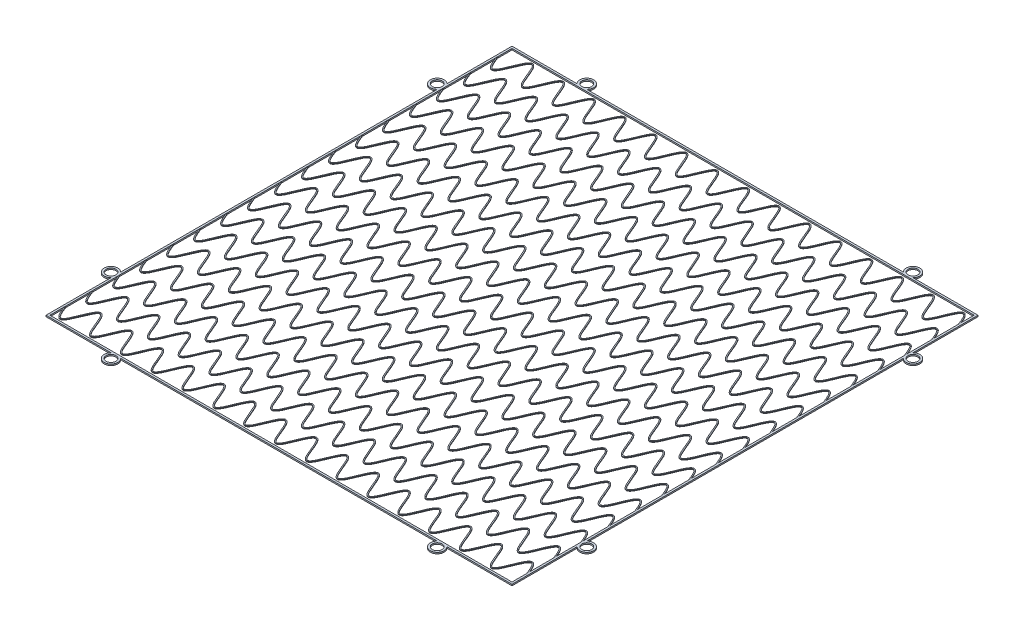
from build123d import *

# Parameters (mm, degrees)
SKETCH1_W                     = 190
SKETCH1_H                     = 190
SKETCH1_W_2                   = 188.4
SKETCH1_H_2                   = 188.4
BOSS_EXTRUDE1_DEPTH           = 0.28
SKETCH5_R                     = 2.8
SKETCH5_R_2                   = 2
BOSS_EXTRUDE5_DEPTH           = 0.28
CIRPATTERN1_COPY_1_SKETCH_R   = 2.8
CIRPATTERN1_COPY_1_SKETCH_R_2 = 2
CIRPATTERN1_COPY_1_DEPTH      = 0.28
CIRPATTERN1_COPY_2_SKETCH_R   = 2.8
CIRPATTERN1_COPY_2_SKETCH_R_2 = 2
CIRPATTERN1_COPY_2_DEPTH      = 0.28
CIRPATTERN1_COPY_3_SKETCH_R   = 2.8
CIRPATTERN1_COPY_3_SKETCH_R_2 = 2
CIRPATTERN1_COPY_3_DEPTH      = 0.28
CIRPATTERN1_COPY_4_SKETCH_R   = 2.8
CIRPATTERN1_COPY_4_SKETCH_R_2 = 2
CIRPATTERN1_COPY_4_DEPTH      = 0.28
CIRPATTERN1_COPY_5_SKETCH_R   = 2.8
CIRPATTERN1_COPY_5_SKETCH_R_2 = 2
CIRPATTERN1_COPY_5_DEPTH      = 0.28
CIRPATTERN1_COPY_6_SKETCH_R   = 2.8
CIRPATTERN1_COPY_6_SKETCH_R_2 = 2
CIRPATTERN1_COPY_6_DEPTH      = 0.28
BOSS_EXTRUDE7_DEPTH           = 0.14
LPATTERN6_COUNT               = 9
LPATTERN6_PITCH               = 11
LPATTERN6_COL_COUNT           = 9
LPATTERN6_COL_PITCH           = 11


with BuildPart() as part:
    # Sketch1 → Boss-Extrude1 (new, symmetric)
    with BuildSketch(Plane(origin=(0, 0, 0), x_dir=(1, 0, 0), z_dir=(0, 1, 0))):
        Rectangle(SKETCH1_W, SKETCH1_H)
        Rectangle(SKETCH1_W_2, SKETCH1_H_2, mode=Mode.SUBTRACT)
    extrude(amount=BOSS_EXTRUDE1_DEPTH, both=True)

    # Sketch5 → Boss-Extrude5 (add, symmetric)
    with BuildSketch(Plane(origin=(0, 0, 0), x_dir=(1, 0, 0), z_dir=(0, 1, 0))):
        with Locations((-66.5, 97)):
            Circle(SKETCH5_R)
        with Locations((-66.5, 97)):
            Circle(SKETCH5_R_2, mode=Mode.SUBTRACT)
    boss_extrude5 = extrude(amount=BOSS_EXTRUDE5_DEPTH, both=True)

    # Mirror2: Boss-Extrude5 across plane
    add(boss_extrude5.mirror(Plane(origin=(0, 0, 0), x_dir=(0, 0, 1), z_dir=(1, 0, 0))))

    # CirPattern1 copy 1 sketch → CirPattern1 copy 1 (add, symmetric)
    with BuildSketch(Plane.ZX):
        with Locations((-66.5, -97)):
            Circle(CIRPATTERN1_COPY_1_SKETCH_R)
        with Locations((-66.5, -97)):
            Circle(CIRPATTERN1_COPY_1_SKETCH_R_2, mode=Mode.SUBTRACT)
    extrude(amount=CIRPATTERN1_COPY_1_DEPTH, both=True)

    # CirPattern1 copy 2 sketch → CirPattern1 copy 2 (add, symmetric)
    with BuildSketch(Plane(origin=(0, 0, 0), x_dir=(1, 0, 0), z_dir=(0, 1, 0))):
        with Locations((-66.5, -97)):
            Circle(CIRPATTERN1_COPY_2_SKETCH_R)
        with Locations((-66.5, -97)):
            Circle(CIRPATTERN1_COPY_2_SKETCH_R_2, mode=Mode.SUBTRACT)
    extrude(amount=CIRPATTERN1_COPY_2_DEPTH, both=True)

    # CirPattern1 copy 3 sketch → CirPattern1 copy 3 (add, symmetric)
    with BuildSketch(Plane(origin=(0, 0, 0), x_dir=(0, 0, -1), z_dir=(0, 1, 0))):
        with Locations((-66.5, -97)):
            Circle(CIRPATTERN1_COPY_3_SKETCH_R)
        with Locations((-66.5, -97)):
            Circle(CIRPATTERN1_COPY_3_SKETCH_R_2, mode=Mode.SUBTRACT)
    extrude(amount=CIRPATTERN1_COPY_3_DEPTH, both=True)

    # CirPattern1 copy 4 sketch → CirPattern1 copy 4 (add, symmetric)
    with BuildSketch(Plane(origin=(0, 0, 0), x_dir=(0, 0, -1), z_dir=(0, 1, 0))):
        with Locations((-66.5, 97)):
            Circle(CIRPATTERN1_COPY_4_SKETCH_R)
        with Locations((-66.5, 97)):
            Circle(CIRPATTERN1_COPY_4_SKETCH_R_2, mode=Mode.SUBTRACT)
    extrude(amount=CIRPATTERN1_COPY_4_DEPTH, both=True)

    # CirPattern1 copy 5 sketch → CirPattern1 copy 5 (add, symmetric)
    with BuildSketch(Plane(origin=(0, 0, 0), x_dir=(-1, 0, 0), z_dir=(0, 1, 0))):
        with Locations((-66.5, 97)):
            Circle(CIRPATTERN1_COPY_5_SKETCH_R)
        with Locations((-66.5, 97)):
            Circle(CIRPATTERN1_COPY_5_SKETCH_R_2, mode=Mode.SUBTRACT)
    extrude(amount=CIRPATTERN1_COPY_5_DEPTH, both=True)

    # CirPattern1 copy 6 sketch → CirPattern1 copy 6 (add, symmetric)
    with BuildSketch(Plane.ZX):
        with Locations((-66.5, 97)):
            Circle(CIRPATTERN1_COPY_6_SKETCH_R)
        with Locations((-66.5, 97)):
            Circle(CIRPATTERN1_COPY_6_SKETCH_R_2, mode=Mode.SUBTRACT)
    extrude(amount=CIRPATTERN1_COPY_6_DEPTH, both=True)

    # Sketch7 → Boss-Extrude7 (add, symmetric)
    with BuildSketch(Plane(origin=(0, 0, 0), x_dir=(1, 0, 0), z_dir=(0, 1, 0))):
        with BuildLine():
            Line((-94.685489828, 0.554091088), (-94.314510172, 0.703670816))
            add(Edge.make_bspline(
                [(-94.314510172, 0.703670816), (-94.128494798, 0.242325418), (-93.761903233, -0.683203832), (-93.192852688, -2.059886185), (-92.667618905, -3.177428949), (-92.165540755, -4.007346752), (-91.716185593, -4.563714084), (-91.156659676, -4.893908285), (-90.586699039, -4.648705896), (-90.117716455, -4.109195202), (-89.603580132, -3.29121727), (-89.070727979, -2.177262894), (-88.499213638, -0.804867906), (-87.948749701, 0.583320642), (-87.477891527, 1.739855344), (-87.070151195, 2.656429537), (-86.738685712, 3.336121208), (-86.364064729, 4.000121082), (-85.989384643, 4.530070706), (-85.602894778, 4.908235083), (-85.24048297, 5.143238917), (-84.769176765, 5.23751202), (-84.317703486, 5.098514882), (-83.976320958, 4.850935351), (-83.602591101, 4.460581349), (-83.239889018, 3.932726938), (-82.866977154, 3.256968888), (-82.436109528, 2.362617595), (-81.940629106, 1.191906265), (-81.404119165, -0.156617005), (-80.881594555, -1.456526327), (-80.310521193, -2.755938727), (-79.763427295, -3.788613147), (-79.204522614, -4.503760835), (-78.681734974, -4.866897038), (-78.134169762, -4.733775295), (-77.504623811, -4.091671717), (-76.927633096, -3.081733452), (-76.341238658, -1.798914294), (-75.805723227, -0.484745389), (-75.280833872, 0.837530825), (-74.73578358, 2.158497939), (-74.230570506, 3.243228942), (-73.744107916, 4.084822884), (-73.376837506, 4.582795777), (-72.998253455, 4.93823565), (-72.643031682, 5.153663512), (-72.193280663, 5.233087602), (-71.622403123, 5.058207659), (-71.144933526, 4.601577433), (-70.716453303, 4.001197283), (-70.358388712, 3.367671466), (-69.934214501, 2.506169151), (-69.463818009, 1.409614608), (-68.93403426, 0.087170552), (-68.40710164, -1.233210684), (-67.8485313, -2.530929663), (-67.318973699, -3.579274036), (-66.794288718, -4.325238123), (-66.306441529, -4.781384183), (-65.757413329, -4.841515331), (-65.2471057, -4.435520195), (-64.83806065, -3.891747249), (-64.370642442, -3.089498002), (-63.872602729, -2.025572153), (-63.331136384, -0.715245093), (-62.806562432, 0.60649047), (-62.267758617, 1.928651361), (-61.774340878, 3.017452795), (-61.312387097, 3.867163697), (-60.900986581, 4.477453287), (-60.461950739, 4.946273679), (-59.94895651, 5.19887112), (-59.488144509, 5.212686878), (-59.089178427, 5.039114683), (-58.677180963, 4.706736222), (-58.28954234, 4.215226754), (-57.911363977, 3.590967875), (-57.471787283, 2.733999354), (-56.99238117, 1.64031626), (-56.45916812, 0.318115607), (-55.933858808, -1.00359516), (-55.38373935, -2.30639441), (-54.86971653, -3.365039626), (-54.372971049, -4.136324684), (-53.923994577, -4.645283521), (-53.382888306, -4.886096357), (-52.846506633, -4.606052852), (-52.405750349, -4.088585077), (-51.916622398, -3.30972331), (-51.405005409, -2.250864972), (-50.857182703, -0.945551942), (-50.331920909, 0.375573056), (-49.797882188, 1.698157737), (-49.315712806, 2.791196448), (-48.872236359, 3.645929042), (-48.487886558, 4.269423317), (-48.091895373, 4.755706226), (-47.662785204, 5.077336705), (-47.246075073, 5.226676592), (-46.789987449, 5.174638744), (-46.300349108, 4.899112528), (-45.873174771, 4.425955905), (-45.469954098, 3.811914845), (-45.012091608, 2.961188527), (-44.522226108, 1.870677362), (-43.9845252, 0.549043554), (-43.459909943, -0.773332808), (-42.916949649, -2.08133411), (-42.416097256, -3.146182478), (-41.943051054, -3.940773153), (-41.527446183, -4.480163119), (-41.008654755, -4.859073947), (-40.460677237, -4.751332344), (-39.981974331, -4.277957237), (-39.466270131, -3.526698179), (-38.939473518, -2.475100949), (-38.383855818, -1.175425136), (-37.857047496, 0.144693649), (-37.326685146, 1.467457173), (-36.854270171, 2.563612341), (-36.42615035, 3.42324648), (-36.063743808, 4.055380223), (-35.700350052, 4.555142803), (-35.328659748, 4.914505247), (-34.982015773, 5.136961034), (-34.538770972, 5.234602119), (-34.101953654, 5.122248089), (-33.762022921, 4.893722158), (-33.395900343, 4.533031331), (-33.035951505, 4.029512197), (-32.555254024, 3.187894749), (-32.053708871, 2.100470333), (-31.510238874, 0.779970273), (-30.985318855, -0.542577167), (-30.448907084, -1.85578361), (-29.858985143, -3.136817427), (-29.275260434, -4.143687594), (-28.633160376, -4.76558864), (-28.084348201, -4.851526211), (-27.569612614, -4.45991345), (-27.019746319, -3.737704329), (-26.476527624, -2.698820184), (-25.911284672, -1.404567107), (-25.382098139, -0.08617039), (-24.854432582, 1.236631702), (-24.39020451, 2.334946358), (-23.975334514, 3.199331985), (-23.630845631, 3.837158742), (-23.223444904, 4.449618291), (-22.791082488, 4.92093161), (-22.291173985, 5.186311582), (-21.832200548, 5.221112497), (-21.423465799, 5.060211559), (-21.002629267, 4.733435363), (-20.610136743, 4.244230333), (-20.228946242, 3.621151892), (-19.897359929, 2.979035879), (-19.494497965, 2.110431841), (-19.03663901, 1.010805281), (-18.510539009, -0.311863596), (-17.978571083, -1.628077869), (-17.401565119, -2.916855507), (-16.840172716, -3.938511855), (-16.249056893, -4.624106884), (-15.710005585, -4.88663591), (-15.170892188, -4.627737831), (-14.578014886, -3.943343427), (-14.016491817, -2.921397598), (-13.439666288, -1.632980836), (-12.9072041, -0.31694345), (-12.381370571, 1.005711662), (-11.923708982, 2.105508307), (-11.520828402, 2.974207402), (-11.189788345, 3.615685301), (-10.808715564, 4.240611419), (-10.417784145, 4.728917382), (-9.997666945, 5.056897917), (-9.590660393, 5.219878709), (-9.131329036, 5.188453153), (-8.629005584, 4.924668757), (-8.195408843, 4.454090383), (-7.788391532, 3.841819284), (-7.442709359, 3.204507417), (-7.028189502, 2.339661875), (-6.563542195, 1.241667547), (-6.035641176, -0.08094434), (-5.506913501, -1.399841973), (-4.941323937, -2.693927294), (-4.398769275, -3.73216921), (-3.850203087, -4.45651805), (-3.335664339, -4.849861734), (-2.786866708, -4.768336161), (-2.14309731, -4.147370411), (-1.559406929, -3.141104911), (-0.969284451, -1.860933993), (-0.432492078, -0.54742431), (0.092298065, 0.774572311), (0.635459327, 2.096219287), (1.137441025, 3.181241724), (1.616504064, 4.026980644), (2.049040838, 4.623348211), (2.535068196, 5.078364427), (3.11570811, 5.234858089), (3.559880349, 5.139827931), (3.908209744, 4.917734888), (4.280640002, 4.560833088), (4.64452035, 4.058905987), (5.007910475, 3.42885769), (5.435935562, 2.568114264), (5.908692127, 1.472469752), (6.439297166, 0.150015374), (6.965695509, -1.170791073), (7.521836137, -2.469866243), (8.04689674, -3.521485774), (8.563506248, -4.274594006), (9.040657172, -4.748433665), (9.588684072, -4.860520428), (10.107407287, -4.483630995), (10.524409018, -3.946091042), (10.99734601, -3.149608943), (11.498920672, -2.087022616), (12.041988029, -0.777952772), (12.566665858, 0.54363949), (13.10405011, 1.865944382), (13.594283143, 2.95601925), (14.050798535, 3.80711305), (14.454320772, 4.421612373), (14.880353675, 4.895424935), (15.367574466, 5.172239049), (15.82315222, 5.227582354), (16.24136579, 5.080645713), (16.671583366, 4.759956103), (17.069038542, 4.273146876), (17.453438663, 3.651306643), (17.897698565, 2.795925246), (18.379791394, 1.70304243), (18.914119227, 0.380968305), (19.439148541, -0.940978456), (19.987197271, -2.245215524), (20.497411257, -3.305837628), (20.987352593, -4.083771478), (21.426391913, -4.602337983), (21.962914499, -4.885905189), (22.504059125, -4.648740003), (22.954602695, -4.140828807), (23.450403734, -3.36921967), (23.965996137, -2.311971932), (24.515786368, -1.008170741), (25.041384316, 0.312734247), (25.574319667, 1.63538497), (26.053684062, 2.729384853), (26.49271395, 3.585444171), (26.870669164, 4.211694826), (27.256705442, 4.70192738), (27.668316244, 5.035846508), (28.065362869, 5.211133562), (28.526356426, 5.200748076), (29.041711292, 4.950083713), (29.482108397, 4.482051058), (29.893127573, 3.871709584), (30.356574162, 3.022820495), (30.849554869, 1.933320528), (31.388677844, 0.611887266), (31.913260587, -0.710590438), (32.454472687, -2.019919703), (32.952142941, -3.086122136), (33.419233229, -3.886336954), (33.827481823, -4.432395441), (34.337397294, -4.839555909), (34.886312762, -4.784108414), (35.375582298, -4.328326831), (35.899734166, -3.584779125), (36.43087732, -2.536034936), (36.988921482, -1.23787233), (37.516289942, 0.08187175), (38.045842035, 1.404599529), (38.515820482, 2.501607559), (38.940267568, 3.362191199), (39.297093596, 3.997251247), (39.725737042, 4.596389441), (40.201058985, 5.05432859), (40.77031624, 5.232509506), (41.220713353, 5.156442557), (41.577854005, 4.941354366), (41.956865287, 4.588484076), (42.324983464, 4.088317329), (42.812469083, 3.249339212), (43.317602943, 2.162936282), (43.862852517, 0.842842555), (44.387939285, -0.479833638), (44.923027252, -1.793832621), (45.509330121, -3.07739281), (46.086401577, -4.087709765), (46.714282443, -4.730843856), (47.26174491, -4.868053755), (47.784405238, -4.507451862), (48.345093203, -3.794085768), (48.893051961, -2.759568721), (49.461254965, -1.466795825), (49.991242076, -0.148994631), (50.518317381, 1.17379921), (50.980629777, 2.272548528), (51.392074394, 3.138212129), (51.732618908, 3.777040182), (52.132302242, 4.393447552), (52.552284455, 4.869736058), (53.027350661, 5.156811928), (53.478062765, 5.232009496), (53.905284509, 5.100329689), (54.345430897, 4.786305588), (54.748017018, 4.30197338), (55.135644268, 3.681410003), (55.470833956, 3.040527397), (55.876681804, 2.172872364), (56.336275866, 1.073645535), (56.862775787, -0.249027995), (57.393769152, -1.566038671), (57.967462056, -2.856347132), (58.523597564, -3.882732842), (59.101907395, -4.580266038), (59.635812709, -4.883753658), (60.179123826, -4.669380464), (60.785244972, -3.998812548), (61.352265786, -2.981571918), (61.932573733, -1.69505059), (62.466091476, -0.37971277), (62.991588614, 0.942840961), (63.44766564, 2.042989372), (63.847577855, 2.91269042), (64.175372409, 3.555145043), (64.550227593, 4.182691228), (64.931582668, 4.674755106), (65.335095161, 5.014237014), (65.722124457, 5.200556887), (66.183170096, 5.211366129), (66.711690298, 4.97534857), (67.159447575, 4.509837188), (67.574400175, 3.901546241), (67.924423896, 3.265622528), (68.342446571, 2.401958639), (68.809151782, 1.304478931), (69.337703189, -0.018083637), (69.865699267, -1.337581078), (70.428562841, -2.633041433), (70.966120793, -3.675254843), (71.505269898, -4.408242002), (72.010429765, -4.82794938), (72.559654932, -4.799153131), (73.053936218, -4.353063775), (73.450785419, -3.799457336), (73.909505611, -2.988718916), (74.401903323, -1.922435375), (74.94088963, -0.610226538), (75.465416345, 0.711727684), (76.006866663, 2.033590364), (76.505663485, 3.120059049), (76.977807075, 3.967396084), (77.402588347, 4.569321891), (77.868196232, 5.029886184), (78.425202208, 5.228066965), (78.8805418, 5.17183914), (79.246864592, 4.96458432), (79.632806173, 4.615978164), (80.005121286, 4.117595171), (80.373765922, 3.489538744), (80.697916928, 2.84525105), (80.996567122, 2.189886425), (81.274744368, 1.53830723), (81.538784563, 0.894040148), (81.828608358, 0.170778564), (82.127041486, -0.576041276), (82.517299355, -1.534559041), (83.041542662, -2.741559), (83.644650732, -3.879582985), (84.297242515, -4.651524768), (84.901034271, -4.901286772), (85.486537893, -4.515224254), (86.098488941, -3.713122173), (86.6897854, -2.557622909), (87.304870088, -1.117191451), (87.886047442, 0.34553715), (88.378217338, 1.566240649), (88.802622342, 2.534562022), (89.146954004, 3.253149213), (89.536216163, 3.955511446), (89.926647561, 4.517010824), (90.333221927, 4.915800757), (90.721000837, 5.161547025), (91.227936433, 5.235471282), (91.68533783, 5.057930318), (92.027788106, 4.781996448), (92.40111828, 4.363821337), (92.771402606, 3.795474058), (93.148613103, 3.086511331), (93.597350827, 2.127687896), (94.103491087, 0.906597852), (94.489184093, -0.067224085), (94.685489828, -0.554091088)],
                knots=[0.003165429, 0.003165429, 0.003165429, 0.003165429, 0.007047133, 0.010928837, 0.014810542, 0.016751394, 0.018692246, 0.020633099, 0.022573951, 0.024514803, 0.026455655, 0.03033736, 0.034219064, 0.038100769, 0.041982473, 0.043923325, 0.045864178, 0.04780503, 0.049745882, 0.050716308, 0.051686734, 0.05265716, 0.053627586, 0.054598013, 0.055568439, 0.057509291, 0.059450143, 0.061390995, 0.0652727, 0.069154404, 0.073036109, 0.076917813, 0.080799518, 0.08274037, 0.084681222, 0.086622074, 0.088562927, 0.092444631, 0.096326335, 0.10020804, 0.104089744, 0.107971449, 0.111853153, 0.113794005, 0.115734858, 0.116705284, 0.11767571, 0.118646136, 0.119616562, 0.121557414, 0.123498267, 0.125439119, 0.127379971, 0.131261675, 0.13514338, 0.139025084, 0.142906789, 0.146788493, 0.148729346, 0.150670198, 0.15261105, 0.154551902, 0.156492754, 0.158433607, 0.162315311, 0.166197016, 0.17007872, 0.173960424, 0.177842129, 0.179782981, 0.181723833, 0.183664686, 0.184635112, 0.185605538, 0.186575964, 0.18754639, 0.189487242, 0.191428095, 0.193368947, 0.197250651, 0.201132356, 0.20501406, 0.208895765, 0.212777469, 0.214718321, 0.216659173, 0.218600026, 0.220540878, 0.22248173, 0.224422582, 0.228304287, 0.232185991, 0.236067696, 0.2399494, 0.243831105, 0.245771957, 0.247712809, 0.249653661, 0.250624087, 0.251594514, 0.25256494, 0.253535366, 0.255476218, 0.25741707, 0.259357922, 0.263239627, 0.267121331, 0.271003036, 0.27488474, 0.278766445, 0.280707297, 0.282648149, 0.284589001, 0.286529854, 0.288470706, 0.290411558, 0.294293263, 0.298174967, 0.302056671, 0.305938376, 0.30982008, 0.311760933, 0.313701785, 0.315642637, 0.316613063, 0.317583489, 0.318553915, 0.319524341, 0.320494768, 0.321465194, 0.323406046, 0.325346898, 0.329228603, 0.333110307, 0.336992011, 0.340873716, 0.34475542, 0.348637125, 0.350577977, 0.352518829, 0.354459682, 0.356400534, 0.360282238, 0.364163943, 0.368045647, 0.371927352, 0.375809056, 0.377749908, 0.37969076, 0.381631613, 0.383572465, 0.384542891, 0.385513317, 0.386483743, 0.387454169, 0.389395022, 0.391335874, 0.393276726, 0.395217578, 0.399099283, 0.402980987, 0.406862692, 0.410744396, 0.414626101, 0.416566953, 0.418507805, 0.420448657, 0.422389509, 0.426271214, 0.430152918, 0.434034623, 0.437916327, 0.441798032, 0.443738884, 0.445679736, 0.447620588, 0.449561441, 0.450531867, 0.451502293, 0.452472719, 0.453443145, 0.455383997, 0.45732485, 0.459265702, 0.461206554, 0.465088258, 0.468969963, 0.472851667, 0.476733372, 0.480615076, 0.482555928, 0.484496781, 0.486437633, 0.488378485, 0.49226019, 0.496141894, 0.500023598, 0.503905303, 0.507787007, 0.511668712, 0.513609564, 0.515550416, 0.517491269, 0.518461695, 0.519432121, 0.520402547, 0.521372973, 0.523313825, 0.525254677, 0.52719553, 0.531077234, 0.534958939, 0.538840643, 0.542722347, 0.546604052, 0.548544904, 0.550485756, 0.552426609, 0.554367461, 0.556308313, 0.558249165, 0.56213087, 0.566012574, 0.569894279, 0.573775983, 0.577657688, 0.57959854, 0.581539392, 0.583480244, 0.58445067, 0.585421096, 0.586391523, 0.587361949, 0.589302801, 0.591243653, 0.593184505, 0.59706621, 0.600947914, 0.604829619, 0.608711323, 0.612593028, 0.61453388, 0.616474732, 0.618415584, 0.620356437, 0.622297289, 0.624238141, 0.628119845, 0.63200155, 0.635883254, 0.639764959, 0.643646663, 0.645587515, 0.647528368, 0.64946922, 0.650439646, 0.651410072, 0.652380498, 0.653350924, 0.655291777, 0.657232629, 0.659173481, 0.663055185, 0.66693689, 0.670818594, 0.674700299, 0.678582003, 0.680522856, 0.682463708, 0.68440456, 0.686345412, 0.688286264, 0.690227117, 0.694108821, 0.697990526, 0.70187223, 0.705753934, 0.709635639, 0.711576491, 0.713517343, 0.715458196, 0.717399048, 0.718369474, 0.7193399, 0.720310326, 0.721280752, 0.723221605, 0.725162457, 0.729044161, 0.732925866, 0.73680757, 0.740689275, 0.744570979, 0.748452683, 0.750393536, 0.752334388, 0.75427524, 0.756216092, 0.760097797, 0.763979501, 0.767861206, 0.77174291, 0.775624615, 0.777565467, 0.779506319, 0.781447171, 0.783388024, 0.78435845, 0.785328876, 0.786299302, 0.787269728, 0.78921058, 0.791151432, 0.793092285, 0.795033137, 0.798914841, 0.802796546, 0.80667825, 0.810559955, 0.814441659, 0.816382511, 0.818323364, 0.820264216, 0.822205068, 0.826086773, 0.829968477, 0.833850181, 0.837731886, 0.84161359, 0.843554443, 0.845495295, 0.847436147, 0.849376999, 0.850347425, 0.851317851, 0.852288278, 0.853258704, 0.855199556, 0.857140408, 0.85908126, 0.861022113, 0.864903817, 0.868785521, 0.872667226, 0.87654893, 0.880430635, 0.882371487, 0.884312339, 0.886253192, 0.888194044, 0.890134896, 0.892075748, 0.895957453, 0.899839157, 0.903720862, 0.907602566, 0.91148427, 0.913425123, 0.915365975, 0.917306827, 0.918277253, 0.919247679, 0.920218105, 0.921188532, 0.923129384, 0.925070236, 0.927011088, 0.92895194, 0.930892793, 0.932833645, 0.934774497, 0.936715349, 0.938656202, 0.942537906, 0.946419611, 0.948360463, 0.950301315, 0.952242167, 0.954183019, 0.958064724, 0.961946428, 0.965828133, 0.969709837, 0.971650689, 0.973591542, 0.975532394, 0.977473246, 0.978443672, 0.979414098, 0.980384524, 0.981354951, 0.982325377, 0.983295803, 0.985236655, 0.987177507, 0.98911836, 0.993000064, 0.996881768, 0.996881768, 0.996881768, 0.996881768], degree=3))
            Line((94.685489828, -0.554091088), (94.314510172, -0.703670816))
            add(Edge.make_bspline(
                [(-94.685489828, 0.554091088), (-94.499408378, 0.092581811), (-94.133642052, -0.83013856), (-93.655676225, -1.989545284), (-93.238410086, -2.900108336), (-92.8932455, -3.578198071), (-92.496977127, -4.232297741), (-92.085559863, -4.747075316), (-91.636134725, -5.084790482), (-91.192399426, -5.23496878), (-90.716171987, -5.155664576), (-90.22487776, -4.847905595), (-89.792462212, -4.343053319), (-89.382928485, -3.69269154), (-89.031560975, -3.019666497), (-88.607715946, -2.107954278), (-88.128010118, -0.953394921), (-87.577103016, 0.435756207), (-87.014755914, 1.814645091), (-86.503233919, 2.938636051), (-86.023362461, 3.789990263), (-85.607680941, 4.373057567), (-85.08078493, 4.830862209), (-84.503279776, 4.797297582), (-83.988278684, 4.312124406), (-83.445973676, 3.526359109), (-82.897600321, 2.42425604), (-82.31222601, 1.044357638), (-81.775835607, -0.304624574), (-81.251201874, -1.608969916), (-80.769375391, -2.70800017), (-80.333187345, -3.565702736), (-79.956237089, -4.191433638), (-79.573430242, -4.684699366), (-79.167980792, -5.020930126), (-78.777289453, -5.204340372), (-78.316312124, -5.208073296), (-77.79217188, -4.967298665), (-77.347234037, -4.500532429), (-76.932480806, -3.892170103), (-76.468135398, -3.043041766), (-75.973374873, -1.95479891), (-75.433946419, -0.632704962), (-74.909398094, 0.689088136), (-74.368573921, 1.999907054), (-73.871968992, 3.064413053), (-73.40678436, 3.868901354), (-73.00089101, 4.415192029), (-72.494433096, 4.832119955), (-71.945105571, 4.79408072), (-71.452157277, 4.34582924), (-70.925713455, 3.603081443), (-70.392673101, 2.557077695), (-69.833920147, 1.258663154), (-69.306028545, -0.060336962), (-68.777295913, -1.383743043), (-68.307147017, -2.480307872), (-67.885027688, -3.341686649), (-67.529076242, -3.977624768), (-67.104052536, -4.577764217), (-66.634780709, -5.037888903), (-66.073683967, -5.229769895), (-65.619628941, -5.166815339), (-65.25689338, -4.957664557), (-64.87236001, -4.605809774), (-64.501843783, -4.10931748), (-64.134378218, -3.478906286), (-63.810445017, -2.835210265), (-63.414091535, -1.964353451), (-62.959895834, -0.863786284), (-62.434724144, 0.458593861), (-61.899771656, 1.773045465), (-61.314898189, 3.056860441), (-60.740535218, 4.068526159), (-60.116873627, 4.718414369), (-59.570212275, 4.872587365), (-59.044411585, 4.522806199), (-58.481100541, 3.81294507), (-57.930618769, 2.780398155), (-57.361658776, 1.487548478), (-56.831131756, 0.170423919), (-56.304547085, -1.152706217), (-55.842535849, -2.251676216), (-55.432350701, -3.11702876), (-55.093446851, -3.757728656), (-54.695744848, -4.373441978), (-54.279863862, -4.852190958), (-53.812752762, -5.145764289), (-53.366110384, -5.233808485), (-52.93298366, -5.112964325), (-52.485902965, -4.804280429), (-52.080188167, -4.322017325), (-51.689643764, -3.701285557), (-51.353727756, -3.061208665), (-50.946423648, -2.194050196), (-50.486376093, -1.094788491), (-49.959947119, 0.227962724), (-49.428855849, 1.54495966), (-48.856734884, 2.835784494), (-48.302551864, 3.864477503), (-47.72737969, 4.565411016), (-47.195952993, 4.88151293), (-46.65185987, 4.682913676), (-46.040947245, 4.018175938), (-45.471758882, 3.002130463), (-44.890372456, 1.715743393), (-44.35639895, 0.401012451), (-43.831019993, -0.921583435), (-43.375714349, -2.022246612), (-42.976146556, -2.891364945), (-42.650463116, -3.535438199), (-42.276513913, -4.162436378), (-41.898477177, -4.657438731), (-41.500657323, -4.998912422), (-41.119983289, -5.192625318), (-40.660046938, -5.217473457), (-40.122610278, -4.992345719), (-39.670016244, -4.52801971), (-39.251283664, -3.922137109), (-38.900658166, -3.28573335), (-38.480769256, -2.423302732), (-38.013622876, -1.325646931), (-37.485009782, -0.002869331), (-36.956846349, 1.316289664), (-36.395543153, 2.612605245), (-35.858828952, 3.657086999), (-35.323143235, 4.3908556), (-34.821312745, 4.819756983), (-34.271871811, 4.808429178), (-33.773825647, 4.370377498), (-33.375477516, 3.817255686), (-32.914197835, 3.009951149), (-32.421310559, 1.942733694), (-31.88164798, 0.631509375), (-31.357167846, -0.6904342), (-30.816241169, -2.012724806), (-30.319016153, -3.099028121), (-29.848352902, -3.94786777), (-29.427025656, -4.550403963), (-28.966995995, -5.013207563), (-28.418483287, -5.223952554), (-27.960550984, -5.181366946), (-27.588387771, -4.980532415), (-27.196510126, -4.633316351), (-26.821854841, -4.138571413), (-26.451467099, -3.509259535), (-26.017730919, -2.65154198), (-25.541734723, -1.556446613), (-25.010076031, -0.233736079), (-24.483964917, 1.08684154), (-23.931544329, 2.388702426), (-23.410779131, 3.443592349), (-22.906043485, 4.205749136), (-22.442500207, 4.699293817), (-21.897190437, 4.878133913), (-21.368181483, 4.545694072), (-20.94073044, 4.01788936), (-20.458795222, 3.229633091), (-19.953140687, 2.168939021), (-19.407565431, 0.861721607), (-18.882510034, -0.459314023), (-18.347280854, -1.782586771), (-17.860601537, -2.872742696), (-17.411530488, -3.727585096), (-17.017308173, -4.345062174), (-16.607036195, -4.826328311), (-16.151287495, -5.12835074), (-15.71152756, -5.234710669), (-15.27062394, -5.131181437), (-14.812873272, -4.830466815), (-14.401635785, -4.350523832), (-14.00751116, -3.731440796), (-13.557355637, -2.878627851), (-13.07101138, -1.787081375), (-12.535274243, -0.464626755), (-12.01037949, 0.856765081), (-11.465162522, 2.16412867), (-10.95898196, 3.225031121), (-10.478695594, 4.013585719), (-10.05101745, 4.542480561), (-9.522982592, 4.877219212), (-8.97768475, 4.702357866), (-8.51315927, 4.210723331), (-8.007551288, 3.447106228), (-7.486693317, 2.39395334), (-6.934056569, 1.091631974), (-6.40762791, -0.228343675), (-5.87665219, -1.551906747), (-5.399781713, -2.645819214), (-4.967687047, -3.505014936), (-4.596601897, -4.133407562), (-4.223181894, -4.629938658), (-3.832601488, -4.976439566), (-3.461775709, -5.179296452), (-3.004428683, -5.224975752), (-2.453922053, -5.017194542), (-1.992970707, -4.555339129), (-1.57021247, -3.952027636), (-1.099746218, -3.104314212), (-0.601769504, -2.017474649), (-0.060751425, -0.69555984), (0.463773417, 0.626362698), (1.003123402, 1.938298061), (1.496368806, 3.004214951), (1.956377864, 3.813733452), (2.355026322, 4.36587183), (2.851851345, 4.806435726), (3.401219227, 4.821615607), (3.90435861, 4.395100034), (4.439716668, 3.66074023), (4.977470408, 2.617953176), (5.538770227, 1.321030114), (6.067308615, 0.002480055), (6.595358819, -1.320875875), (7.063145232, -2.418171942), (7.481873332, -3.280649259), (7.832691353, -3.918076299), (8.250139476, -4.522903105), (8.701771153, -4.988267212), (9.237252255, -5.216154854), (9.69752556, -5.194454877), (10.07947726, -5.002917484), (10.478954616, -4.660708748), (10.85798454, -4.167734852), (11.231287304, -3.53955521), (11.558275488, -2.896852192), (11.957442307, -2.026904015), (12.413125481, -0.926668203), (12.938547082, 0.395854436), (13.4723482, 1.711011113), (14.053573946, 2.997009156), (14.622056874, 4.013078746), (15.23168669, 4.679715476), (15.775873922, 4.882215283), (16.307958884, 4.568589508), (16.883330331, 3.869162297), (17.43865043, 2.84096328), (18.010799986, 1.549715214), (18.542172047, 0.233202207), (19.068339313, -1.08980891), (19.528388905, -2.189307577), (19.935561071, -3.055704705), (20.270565801, -3.697444361), (20.661317879, -4.316540779), (21.066199734, -4.800312217), (21.511190592, -5.109933217), (21.943075709, -5.233487377), (22.390711573, -5.148389105), (22.859739729, -4.856450021), (23.276701669, -4.378905668), (23.674459014, -3.761553978), (24.014030775, -3.122473249), (24.424611981, -2.256492721), (24.886448856, -1.15763584), (25.41338296, 0.165152658), (25.943587936, 1.482792706), (26.51257095, 2.775180737), (27.061791407, 3.808519134), (27.625333538, 4.519494852), (28.149971353, 4.87145052), (28.696718878, 4.721470497), (29.321694611, 4.073691158), (29.89671715, 3.061951565), (30.481719842, 1.77776056), (31.016934222, 0.463757039), (31.541712853, -0.858798243), (32.087736526, -2.179424905), (32.593097505, -3.264424124), (33.083343443, -4.104351386), (33.452490925, -4.602227045), (33.8361261, -4.953546754), (34.197424088, -5.164509155), (34.650681582, -5.230481828), (35.213767946, -5.041792569), (35.68394961, -4.582483727), (36.110606312, -3.981911012), (36.466093001, -3.346561863), (36.889603342, -2.485595456), (37.358980811, -1.388447775), (37.888334164, -0.065708224), (38.41585617, 1.253923011), (38.97455032, 2.551706729), (39.506816953, 3.599628689), (40.033253743, 4.341208538), (40.525158358, 4.791909474), (41.074234092, 4.833835647), (41.582177107, 4.419277196), (41.987530122, 3.872577458), (42.454219654, 3.069907277), (42.950338128, 2.004415076), (43.491506487, 0.694186009), (44.016065583, -0.627518663), (44.555281432, -1.950154595), (45.04958932, -3.037501294), (45.513781903, -3.888188783), (45.927520732, -4.495272557), (46.371410852, -4.963128398), (46.893653485, -5.206476964), (47.354696024, -5.205919311), (47.746643265, -5.024798161), (48.15403123, -4.687963663), (48.537635701, -4.196788866), (48.913998642, -3.569866622), (49.351922678, -2.713472947), (49.830581523, -1.619235891), (50.363246711, -0.296571875), (50.888940486, 1.024271558), (51.43925692, 2.32767776), (51.955884038, 3.384476638), (52.453474835, 4.154182147), (52.906589579, 4.659360443), (53.448851818, 4.885078609), (53.983592867, 4.590797095), (54.420522676, 4.071179366), (54.908510282, 3.289087006), (55.41807649, 2.230295798), (55.965447407, 0.924330866), (56.490797427, -0.3964365), (57.024737825, -1.719853359), (57.508656011, -2.811040058), (57.95274271, -3.667224812), (58.340164365, -4.287914479), (58.73979873, -4.774115161), (59.174660325, -5.090631795), (59.597863632, -5.230154003), (60.051011169, -5.164456274), (60.531913253, -4.882237805), (60.954798898, -4.407146159), (61.356346724, -3.791644202), (61.811522812, -2.940201207), (62.300947368, -1.849811741), (62.837983328, -0.527474052), (63.362697229, 0.794080398), (63.906192582, 2.10280835), (64.408692037, 3.165061889), (64.883099303, 3.959967937), (65.302209487, 4.49584084), (65.822996592, 4.864575347), (66.370460217, 4.739431531), (66.845695264, 4.261782227), (67.358637209, 3.505709608), (67.883967787, 2.455008112), (68.438779503, 1.154126223), (68.965713967, -0.165509187), (69.495760252, -1.48905346), (69.970104722, -2.583945182), (70.3981936, -3.44409834), (70.763689351, -4.075129258), (71.12850441, -4.574354597), (71.505486245, -4.930258609), (71.857665018, -5.148422275), (72.305435114, -5.233920214), (72.880353943, -5.066046923), (73.36071768, -4.609502423), (73.791297276, -4.011679827), (74.268509859, -3.165509024), (74.769669981, -2.080111945), (75.312420054, -0.758420431), (75.836973397, 0.563629459), (76.374935683, 1.876574081), (76.86494512, 2.943986536), (77.319999324, 3.757996833), (77.711865466, 4.315907192), (78.198539857, 4.77654027), (78.747182926, 4.844776482), (79.259836797, 4.443615437), (79.804897993, 3.717960863), (80.347246266, 2.679017606), (80.818251622, 1.597381308), (81.167841622, 0.744341041), (81.457082418, 0.022608375), (81.755834701, -0.725225439), (82.148489145, -1.688641565), (82.5715737, -2.668957973), (83.05454227, -3.613463983), (83.480031782, -4.304961101), (83.928617915, -4.840322489), (84.447433582, -5.165782338), (84.956465096, -5.233803155), (85.410860252, -5.05254844), (85.864405993, -4.682534464), (86.282078672, -4.13229364), (86.687363307, -3.436124175), (87.158612028, -2.481835651), (87.675328489, -1.267110596), (88.257950991, 0.198555081), (88.846428674, 1.655656883), (89.378805987, 2.845373764), (89.878584628, 3.74825463), (90.312945702, 4.367254751), (90.870191856, 4.85202477), (91.482500896, 4.770584145), (92.008028099, 4.229970303), (92.424925448, 3.595405203), (92.789740517, 2.90928905), (93.230035395, 1.969081953), (93.731727728, 0.758944105), (94.11831386, -0.217075199), (94.314510172, -0.703670816)],
                knots=[0.003165429, 0.003165429, 0.003165429, 0.003165429, 0.007047133, 0.010928837, 0.01286969, 0.014810542, 0.016751394, 0.018692246, 0.019662672, 0.020633099, 0.021603525, 0.022573951, 0.024514803, 0.026455655, 0.028396507, 0.03033736, 0.034219064, 0.038100769, 0.041982473, 0.045864178, 0.04780503, 0.049745882, 0.051686734, 0.053627586, 0.055568439, 0.057509291, 0.061390995, 0.0652727, 0.069154404, 0.073036109, 0.076917813, 0.078858665, 0.080799518, 0.08274037, 0.083710796, 0.084681222, 0.085651648, 0.086622074, 0.088562927, 0.090503779, 0.092444631, 0.096326335, 0.10020804, 0.104089744, 0.107971449, 0.111853153, 0.113794005, 0.115734858, 0.11767571, 0.119616562, 0.121557414, 0.123498267, 0.127379971, 0.131261675, 0.13514338, 0.139025084, 0.142906789, 0.144847641, 0.146788493, 0.148729346, 0.150670198, 0.151640624, 0.15261105, 0.153581476, 0.154551902, 0.156492754, 0.158433607, 0.160374459, 0.162315311, 0.166197016, 0.17007872, 0.173960424, 0.177842129, 0.181723833, 0.183664686, 0.185605538, 0.18754639, 0.189487242, 0.193368947, 0.197250651, 0.201132356, 0.20501406, 0.208895765, 0.210836617, 0.212777469, 0.214718321, 0.216659173, 0.2176296, 0.218600026, 0.219570452, 0.220540878, 0.22248173, 0.224422582, 0.226363435, 0.228304287, 0.232185991, 0.236067696, 0.2399494, 0.243831105, 0.247712809, 0.249653661, 0.251594514, 0.253535366, 0.255476218, 0.259357922, 0.263239627, 0.267121331, 0.271003036, 0.27488474, 0.276825592, 0.278766445, 0.280707297, 0.282648149, 0.283618575, 0.284589001, 0.285559427, 0.286529854, 0.288470706, 0.290411558, 0.29235241, 0.294293263, 0.298174967, 0.302056671, 0.305938376, 0.30982008, 0.313701785, 0.315642637, 0.317583489, 0.319524341, 0.321465194, 0.323406046, 0.325346898, 0.329228603, 0.333110307, 0.336992011, 0.340873716, 0.34475542, 0.346696273, 0.348637125, 0.350577977, 0.351548403, 0.352518829, 0.353489255, 0.354459682, 0.356400534, 0.358341386, 0.360282238, 0.364163943, 0.368045647, 0.371927352, 0.375809056, 0.37969076, 0.381631613, 0.383572465, 0.385513317, 0.387454169, 0.389395022, 0.391335874, 0.395217578, 0.399099283, 0.402980987, 0.406862692, 0.410744396, 0.412685248, 0.414626101, 0.416566953, 0.417537379, 0.418507805, 0.419478231, 0.420448657, 0.422389509, 0.424330362, 0.426271214, 0.430152918, 0.434034623, 0.437916327, 0.441798032, 0.445679736, 0.447620588, 0.449561441, 0.451502293, 0.453443145, 0.455383997, 0.45732485, 0.461206554, 0.465088258, 0.468969963, 0.472851667, 0.476733372, 0.478674224, 0.480615076, 0.482555928, 0.483526355, 0.484496781, 0.485467207, 0.486437633, 0.488378485, 0.490319337, 0.49226019, 0.496141894, 0.500023598, 0.503905303, 0.507787007, 0.511668712, 0.513609564, 0.515550416, 0.517491269, 0.519432121, 0.521372973, 0.523313825, 0.52719553, 0.531077234, 0.534958939, 0.538840643, 0.542722347, 0.5446632, 0.546604052, 0.548544904, 0.550485756, 0.551456182, 0.552426609, 0.553397035, 0.554367461, 0.556308313, 0.558249165, 0.560190018, 0.56213087, 0.566012574, 0.569894279, 0.573775983, 0.577657688, 0.581539392, 0.583480244, 0.585421096, 0.587361949, 0.589302801, 0.593184505, 0.59706621, 0.600947914, 0.604829619, 0.608711323, 0.610652175, 0.612593028, 0.61453388, 0.616474732, 0.617445158, 0.618415584, 0.61938601, 0.620356437, 0.622297289, 0.624238141, 0.626178993, 0.628119845, 0.63200155, 0.635883254, 0.639764959, 0.643646663, 0.647528368, 0.64946922, 0.651410072, 0.653350924, 0.655291777, 0.659173481, 0.663055185, 0.66693689, 0.670818594, 0.674700299, 0.678582003, 0.680522856, 0.682463708, 0.683434134, 0.68440456, 0.685374986, 0.686345412, 0.688286264, 0.690227117, 0.692167969, 0.694108821, 0.697990526, 0.70187223, 0.705753934, 0.709635639, 0.713517343, 0.715458196, 0.717399048, 0.7193399, 0.721280752, 0.723221605, 0.725162457, 0.729044161, 0.732925866, 0.73680757, 0.740689275, 0.744570979, 0.746511831, 0.748452683, 0.750393536, 0.751363962, 0.752334388, 0.753304814, 0.75427524, 0.756216092, 0.758156945, 0.760097797, 0.763979501, 0.767861206, 0.77174291, 0.775624615, 0.779506319, 0.781447171, 0.783388024, 0.785328876, 0.787269728, 0.78921058, 0.791151432, 0.795033137, 0.798914841, 0.802796546, 0.80667825, 0.810559955, 0.812500807, 0.814441659, 0.816382511, 0.817352937, 0.818323364, 0.81929379, 0.820264216, 0.822205068, 0.82414592, 0.826086773, 0.829968477, 0.833850181, 0.837731886, 0.84161359, 0.845495295, 0.847436147, 0.849376999, 0.851317851, 0.853258704, 0.855199556, 0.857140408, 0.861022113, 0.864903817, 0.868785521, 0.872667226, 0.87654893, 0.878489783, 0.880430635, 0.882371487, 0.883341913, 0.884312339, 0.885282765, 0.886253192, 0.888194044, 0.890134896, 0.892075748, 0.895957453, 0.899839157, 0.903720862, 0.907602566, 0.91148427, 0.913425123, 0.915365975, 0.917306827, 0.919247679, 0.921188532, 0.923129384, 0.927011088, 0.930892793, 0.932833645, 0.934774497, 0.936715349, 0.938656202, 0.942537906, 0.944478758, 0.946419611, 0.948360463, 0.949330889, 0.950301315, 0.951271741, 0.952242167, 0.954183019, 0.956123872, 0.958064724, 0.961946428, 0.965828133, 0.969709837, 0.973591542, 0.975532394, 0.977473246, 0.979414098, 0.981354951, 0.983295803, 0.985236655, 0.987177507, 0.98911836, 0.993000064, 0.996881768, 0.996881768, 0.996881768, 0.996881768], degree=3))
        make_face()
    boss_extrude7 = extrude(amount=BOSS_EXTRUDE7_DEPTH, both=True)

    # LPattern6: Boss-Extrude7 ×9
    with Locations(*[(0, 0, -i * LPATTERN6_PITCH) for i in range(1, LPATTERN6_COUNT)]):
        add(boss_extrude7)

    # LPattern6 col: Boss-Extrude7 ×9
    with Locations(*[(0, 0, i * LPATTERN6_COL_PITCH) for i in range(1, LPATTERN6_COL_COUNT)]):
        add(boss_extrude7)


solid = part.part
